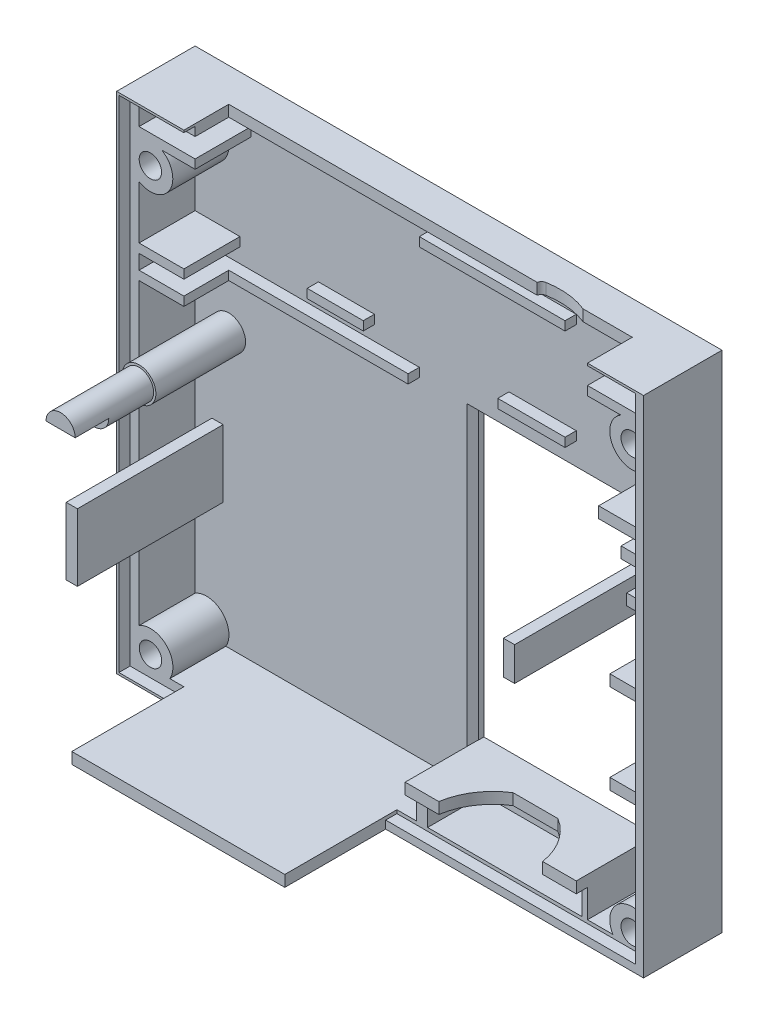
from build123d import *

# Parameters (mm, degrees)
SCHIZZO1_W                           = 47
SCHIZZO1_H                           = 45
ESTRUSIONE_ESTRUSIONE1_DEPTH         = 16
SCHIZZO3_W                           = 5
SCHIZZO3_H                           = 9
SCHIZZO3_W_2                         = 23
TAGLIO_ESTRUSIONE1_DEPTH             = 54.228281956
TAGLIO_ESTRUSIONE2_REACH             = 52.262
SCHIZZO4_W                           = 9
SCHIZZO4_H                           = 44
TAGLIO_ESTRUSIONE3_DEPTH             = 1
FORO_PER_VITE_M3_1_D                 = 2
FORO_PER_VITE_M3_1_DEPTH             = 4
SVUOTA1_START                        = 1
SVUOTA1_DEPTH                        = 5
SCHIZZO11_W                          = 15
SCHIZZO11_H                          = 26
TAGLIO_ESTRUSIONE4_DEPTH             = 36.825968235
TAGLIO_ESTRUSIONE5_REACH             = 55.228
SCHIZZO12_W                          = 36
SCHIZZO12_H                          = 4
TAGLIO_ESTRUSIONE5_DIRECTION_2_DEPTH = 54.228281956
ESTRUSIONE_ESTRUSIONE2_DEPTH         = 6
SCHIZZO14_W                          = 1
SCHIZZO14_H                          = 2.5
TAGLIO_ESTRUSIONE6_DEPTH             = 15.26
TAGLIO_ESTRUSIONE7_REACH             = 51.482
SMUSSO1_SIZE                         = 0.5
SCHIZZO16_W                          = 4
SCHIZZO16_H                          = 1
SCHIZZO16_W_2                        = 2
SCHIZZO16_W_3                        = 20
SCHIZZO16_H_2                        = 0.8
SCHIZZO16_W_4                        = 5
SCHIZZO16_W_5                        = 13
SCHIZZO16_W_6                        = 6
SCHIZZO16_W_7                        = 1.5
ESTRUSIONE_ESTRUSIONE3_DEPTH         = 5
TAGLIO_ESTRUSIONE8_REACH             = 53.1
SCHIZZO17_W                          = 4
SCHIZZO17_H                          = 7
SCHIZZO18_W                          = 29
SCHIZZO18_H                          = 4
TAGLIO_ESTRUSIONE9_DEPTH             = 11.896238686
TAGLIO_ESTRUSIONE10_REACH            = 44.195
SCHIZZO19_W                          = 1
SCHIZZO19_H                          = 4
SCHIZZO20_R                          = 1.5
SCHIZZO20_W                          = 1
SCHIZZO20_H                          = 3
ESTRUSIONE_ESTRUSIONE4_DEPTH         = 15
TAGLIO_ESTRUSIONE11_START            = -7
SCHIZZO21_R                          = 1.5
SCHIZZO21_R_2                        = 1.3
TAGLIO_ESTRUSIONE11_DEPTH            = 7
TAGLIO_ESTRUSIONE12_START            = -3
TAGLIO_ESTRUSIONE12_DEPTH            = 3
SCHIZZO23_W                          = 1
SCHIZZO23_H                          = 6
ESTRUSIONE_ESTRUSIONE5_DEPTH         = 13
TAGLIO_ESTRUSIONE14_REACH            = 55.228


# Read off the part's stored shape, not the designer's step: Svuota1
with BuildPart() as part:
    # Schizzo1 → Estrusione-Estrusione1 (new body)
    with BuildSketch(Plane.XY):
        Rectangle(SCHIZZO1_W, SCHIZZO1_H)
    extrude(amount=ESTRUSIONE_ESTRUSIONE1_DEPTH)

    # Schizzo3 → Taglio-Estrusione1 (cut, through all)
    with BuildSketch(Plane.XZ.offset(22.5)):
        with Locations((-21, 11.5)):
            Rectangle(SCHIZZO3_W, SCHIZZO3_H)
        with Locations((12, 11.5)):
            Rectangle(SCHIZZO3_W_2, SCHIZZO3_H)
    extrude(amount=-TAGLIO_ESTRUSIONE1_DEPTH, mode=Mode.SUBTRACT)

    # Schizzo4 → Taglio-Estrusione2 (cut, up to next)
    with BuildSketch(Plane.ZY.offset(18.5), mode=Mode.PRIVATE) as taglio_estrusione2_sk1:
        with Locations((11.5, 0.5)):
            Rectangle(SCHIZZO4_W, SCHIZZO4_H)
    taglio_estrusione2_tool1 = extrude(taglio_estrusione2_sk1.sketch, amount=-TAGLIO_ESTRUSIONE2_REACH, mode=Mode.PRIVATE) & part.part
    add(taglio_estrusione2_tool1.solids().sort_by_distance((-18.5, 0.5, 11.5))[0], mode=Mode.SUBTRACT)

    # Schizzo5 → Taglio-Estrusione3 (cut)
    with BuildSketch(Plane.XY.offset(7)):
        Polygon((-18.5, -21.5), (-18.5, -22.3), (-23.3, -22.3), (-23.3, 22.3), (22.8, 22.3), (22.8, -21.8), (0.5, -21.8), (0.5, -21.5), align=None)
    extrude(amount=-TAGLIO_ESTRUSIONE3_DEPTH, mode=Mode.SUBTRACT)

    # Foro per Vite M3-1
    with Locations(Plane.XY.offset(6)):
        with Locations((-21.49, 17.25), (-21.48, -20.49), (21.49, -20.49), (21.49, 17.25)):
            Hole(FORO_PER_VITE_M3_1_D / 2, depth=FORO_PER_VITE_M3_1_DEPTH)

    # Svuota1 outline → Svuota1 (cut)
    with BuildSketch(Plane.XY.offset(SVUOTA1_START)):
        with BuildLine():
            ThreePointArc((-22.5, -18.769651198), (-20.069895601, -19.071689179), (-19.753761314, -21.5))
            Line((-19.753761314, -21.5), (19.763761314, -21.5))
            ThreePointArc((19.763761314, -21.5), (20.075786438, -19.075786438), (22.5, -18.763761314))
            Line((22.5, -18.763761314), (22.5, 15.523761314))
            ThreePointArc((22.5, 15.523761314), (19.49, 17.25), (22.5, 18.976238686))
            Line((22.5, 18.976238686), (22.5, 21.5))
            Line((22.5, 21.5), (-22.5, 21.5))
            Line((-22.5, 21.5), (-22.5, 18.976238686))
            ThreePointArc((-22.5, 18.976238686), (-19.49, 17.25), (-22.5, 15.523761314))
            Line((-22.5, 15.523761314), (-22.5, -18.769651198))
        make_face()
    extrude(amount=SVUOTA1_DEPTH, mode=Mode.SUBTRACT)

    # Schizzo11 → Taglio-Estrusione4 (cut, through all)
    with BuildSketch(Plane.XY.offset(1)):
        with Locations((9.76, -5)):
            Rectangle(SCHIZZO11_W, SCHIZZO11_H)
    extrude(amount=-TAGLIO_ESTRUSIONE4_DEPTH, mode=Mode.SUBTRACT)

    # Taglio-Estrusione5: up to this face of the body (flat: up to its plane)
    taglio_estrusione5_end = Plane(part.part.faces().sort_by_distance((0, 21.5, 3.5))[0])
    # Schizzo12 → Taglio-Estrusione5 (cut, up to the picked face)
    with BuildSketch(Plane(origin=(0, 22.5, 0), x_dir=(1, 0, 0), z_dir=(0, 1, 0)), mode=Mode.PRIVATE) as taglio_estrusione5_sk1:
        with Locations((0.5, -5)):
            Rectangle(SCHIZZO12_W, SCHIZZO12_H)
    taglio_estrusione5_tool1 = split(extrude(taglio_estrusione5_sk1.sketch, amount=-TAGLIO_ESTRUSIONE5_REACH, mode=Mode.PRIVATE), bisect_by=taglio_estrusione5_end, keep=Keep.BOTH, mode=Mode.PRIVATE)
    add(taglio_estrusione5_tool1.solids().sort_by(Axis((0.5, 22.5, 5), (0, -1, 0)))[0], mode=Mode.SUBTRACT)

    # Schizzo12 → Taglio-Estrusione5 direction 2 (cut)
    with BuildSketch(Plane(origin=(0, 22.5, 0), x_dir=(1, 0, 0), z_dir=(0, 1, 0))):
        with Locations((0.5, -5)):
            Rectangle(SCHIZZO12_W, SCHIZZO12_H)
    extrude(amount=TAGLIO_ESTRUSIONE5_DIRECTION_2_DEPTH, mode=Mode.SUBTRACT)

    # Schizzo13 → Estrusione-Estrusione2 (add)
    with BuildSketch(Plane.XY.offset(1)):
        Polygon((17.5, -21.5), (17.5, -18), (2.24, -18), (2.24, -21.5), (3.24, -21.5), (3.24, -19), (17, -19), (17, -21.5), align=None)
    extrude(amount=ESTRUSIONE_ESTRUSIONE2_DEPTH)

    # Schizzo14 → Taglio-Estrusione6 (cut)
    with BuildSketch(Plane.ZY.offset(-2.24)):
        with Locations((6.5, -20.25)):
            Rectangle(SCHIZZO14_W, SCHIZZO14_H)
    extrude(amount=-TAGLIO_ESTRUSIONE6_DEPTH, mode=Mode.SUBTRACT)

    # Schizzo15 → Taglio-Estrusione7 (cut, up to next)
    with BuildSketch(Plane(origin=(0, -18, 0), x_dir=(1, 0, 0), z_dir=(0, 1, 0)), mode=Mode.PRIVATE) as taglio_estrusione7_sk1:
        with BuildLine():
            Line((7.87, -3), (11.87, -3))
            ThreePointArc((11.87, -3), (13.620947528, -4.7133645), (14.5, -7))
            Line((14.5, -7), (5.24, -7))
            ThreePointArc((5.24, -7), (6.119052472, -4.7133645), (7.87, -3))
        make_face()
    taglio_estrusione7_tool1 = extrude(taglio_estrusione7_sk1.sketch, amount=-TAGLIO_ESTRUSIONE7_REACH, mode=Mode.PRIVATE) & part.part
    add(taglio_estrusione7_tool1.solids().sort_by_distance((9.87, -18, 5.221754))[0], mode=Mode.SUBTRACT)

    # Smusso1
    smusso1_edges = [part.edges().sort_by_distance(p)[0] for p in [
        (2.26, -5, 1),
        (17.26, -5, 1),
    ]]
    chamfer(smusso1_edges, length=SMUSSO1_SIZE)

    # Schizzo16 → Estrusione-Estrusione3 (add)
    with BuildSketch(Plane.XY.offset(1)):
        Polygon((22.5, -9.5), (22.5, -10.5), (19.5, -10.5), (19.5, -1.5), (22.5, -1.5), (22.5, -2.5), (20.5, -2.5), (20.5, -9.5), align=None)
        with Locations((20.5, 10.48)):
            Rectangle(SCHIZZO16_W, SCHIZZO16_H)
        with Locations((21.5, 8.38)):
            Rectangle(SCHIZZO16_W_2, SCHIZZO16_H)
        with Locations((-12.5, 8.28)):
            Rectangle(SCHIZZO16_W_3, SCHIZZO16_H_2)
        with Locations((-20.5, 10.38)):
            Rectangle(SCHIZZO16_W, SCHIZZO16_H_2)
        with Locations((-20, 19.376238686)):
            Rectangle(SCHIZZO16_W_4, SCHIZZO16_H_2)
        with Locations((20, 19.376238686)):
            Rectangle(SCHIZZO16_W_4, SCHIZZO16_H_2)
        with Locations((5, 19.376238686)):
            Rectangle(SCHIZZO16_W_5, SCHIZZO16_H_2)
        with Locations((8.5, 10.38)):
            Rectangle(SCHIZZO16_W_6, SCHIZZO16_H_2)
        with Locations((-9, 10.38)):
            Rectangle(SCHIZZO16_W_4, SCHIZZO16_H_2)
        with Locations((21.75, 5)):
            Rectangle(SCHIZZO16_W_7, SCHIZZO16_H)
    extrude(amount=ESTRUSIONE_ESTRUSIONE3_DEPTH)

    # Schizzo17 → Taglio-Estrusione8 (cut, up to next)
    with BuildSketch(Plane.ZY.offset(-19.5), mode=Mode.PRIVATE) as taglio_estrusione8_sk1:
        with Locations((4, -6)):
            Rectangle(SCHIZZO17_W, SCHIZZO17_H)
    taglio_estrusione8_tool1 = extrude(taglio_estrusione8_sk1.sketch, amount=-TAGLIO_ESTRUSIONE8_REACH, mode=Mode.PRIVATE) & part.part
    add(taglio_estrusione8_tool1.solids().sort_by_distance((19.5, -6, 4))[0], mode=Mode.SUBTRACT)

    # Schizzo18 → Taglio-Estrusione9 (cut)
    with BuildSketch(Plane(origin=(0, 19.776238686, 0), x_dir=(1, 0, 0), z_dir=(0, 1, 0))):
        with Locations((-3, -4)):
            Rectangle(SCHIZZO18_W, SCHIZZO18_H)
    extrude(amount=-TAGLIO_ESTRUSIONE9_DEPTH, mode=Mode.SUBTRACT)

    # Schizzo19 → Taglio-Estrusione10 (cut, up to next)
    with BuildSketch(Plane(origin=(0, 8.68, 0), x_dir=(1, 0, 0), z_dir=(0, 1, 0)), mode=Mode.PRIVATE) as taglio_estrusione10_sk1:
        with Locations((-18, -4)):
            Rectangle(SCHIZZO19_W, SCHIZZO19_H)
    taglio_estrusione10_tool1 = extrude(taglio_estrusione10_sk1.sketch, amount=-TAGLIO_ESTRUSIONE10_REACH, mode=Mode.PRIVATE) & part.part
    add(taglio_estrusione10_tool1.solids().sort_by_distance((-18, 8.68, 4))[0], mode=Mode.SUBTRACT)

    # Schizzo20 → Estrusione-Estrusione4 (add)
    with BuildSketch(Plane.XY.offset(1)):
        with Locations(Location((-19.5, 2.88, 0), (0, 0, 180))):
            Circle(SCHIZZO20_R)
        with Locations((20.5, 5)):
            Rectangle(SCHIZZO20_W, SCHIZZO20_H)
    extrude(amount=ESTRUSIONE_ESTRUSIONE4_DEPTH)

    # Schizzo21 → Taglio-Estrusione11 (cut)
    with BuildSketch(Plane.XY.offset(16).offset(TAGLIO_ESTRUSIONE11_START)):
        with Locations(Location((-19.5, 2.88, 0), (0, 0, 180))):
            Circle(SCHIZZO21_R)
        with Locations((-19.5, 2.88)):
            Circle(SCHIZZO21_R_2, mode=Mode.SUBTRACT)
    extrude(amount=TAGLIO_ESTRUSIONE11_DEPTH, mode=Mode.SUBTRACT)

    # Schizzo22 → Taglio-Estrusione12 (cut)
    with BuildSketch(Plane.XY.offset(16).offset(TAGLIO_ESTRUSIONE12_START)):
        with BuildLine():
            Line((-20.8, 2.88), (-18.2, 2.88))
            ThreePointArc((-18.2, 2.88), (-19.5, 1.58), (-20.8, 2.88))
        make_face()
    extrude(amount=TAGLIO_ESTRUSIONE12_DEPTH, mode=Mode.SUBTRACT)

    # Schizzo23 → Estrusione-Estrusione5 (add)
    with BuildSketch(Plane.XY.offset(1)):
        with Locations((-20.5, -7.5)):
            Rectangle(SCHIZZO23_W, SCHIZZO23_H)
    extrude(amount=ESTRUSIONE_ESTRUSIONE5_DEPTH)

    # Schizzo25 → Taglio-Estrusione14 (cut, up to next)
    with BuildSketch(Plane(origin=(0, 22.5, 0), x_dir=(1, 0, 0), z_dir=(0, 1, 0)), mode=Mode.PRIVATE) as taglio_estrusione14_sk1:
        with BuildLine():
            Line((14.110810194, -3), (10.011633802, -3))
            ThreePointArc((10.011633802, -3), (10.15430246, -2.745992416), (10.414334326, -2.614624125))
            ThreePointArc((10.414334326, -2.614624125), (12.289339232, -2.550566702), (14.110810194, -3))
        make_face()
    taglio_estrusione14_tool1 = extrude(taglio_estrusione14_sk1.sketch, amount=-TAGLIO_ESTRUSIONE14_REACH, mode=Mode.PRIVATE) & part.part
    add(taglio_estrusione14_tool1.solids().sort_by_distance((11.816989, 22.5, 2.796311))[0], mode=Mode.SUBTRACT)


solid = part.part
